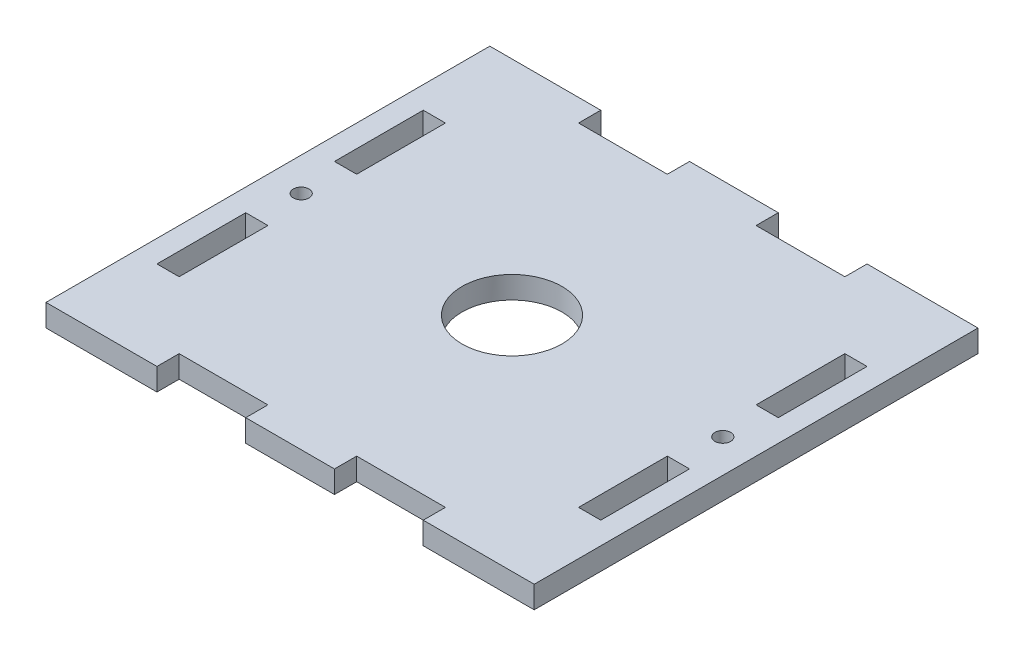
from build123d import *

# Parameters (mm, degrees)
SKETCH1_W                 = 139.7
SKETCH1_H                 = 127
BOSS_EXTRUDE1_DEPTH       = 6.35
SKETCH13_W                = 25.4
SKETCH13_H                = 6.35
CUT_EXTRUDE6_DEPTH        = 6.35
LPATTERN7_COUNT           = 2
LPATTERN7_PITCH           = 120.65
SKETCH14_W                = 6.35
SKETCH14_H                = 25.4
CUT_EXTRUDE7_DEPTH        = 6.35
F_8_CLEARANCE_HOLE1_D     = 4.4958
F_8_CLEARANCE_HOLE1_DEPTH = 10.16
F_8_CLEARANCE_HOLE1_TIP   = 1.350674586
SKETCH18_R                = 14.2875
CUT_EXTRUDE9_DEPTH        = 7.62


with BuildPart() as part:
    # Sketch1 → Boss-Extrude1 (new body)
    with BuildSketch(Plane(origin=(0, 0, 0), x_dir=(1, 0, 0), z_dir=(0, 1, 0))):
        with Locations((69.85, 63.5)):
            Rectangle(SKETCH1_W, SKETCH1_H)
    extrude(amount=BOSS_EXTRUDE1_DEPTH)

    # Sketch13 → Cut-Extrude6 (cut)
    with BuildSketch(Plane(origin=(0, 6.35, 0), x_dir=(1, 0, 0), z_dir=(0, 1, 0))):
        with Locations((44.45, 3.175)):
            Rectangle(SKETCH13_W, SKETCH13_H)
        with Locations((95.25, 3.175)):
            Rectangle(SKETCH13_W, SKETCH13_H)
    cut_extrude6 = extrude(amount=-CUT_EXTRUDE6_DEPTH, mode=Mode.SUBTRACT)

    # LPattern7: Cut-Extrude6 ×2
    with Locations(*[(0, 0, -i * LPATTERN7_PITCH) for i in range(1, LPATTERN7_COUNT)]):
        add(cut_extrude6, mode=Mode.SUBTRACT)

    # Sketch14 → Cut-Extrude7 (cut)
    with BuildSketch(Plane(origin=(0, 6.35, 0), x_dir=(1, 0, 0), z_dir=(0, 1, 0))):
        with Locations((9.525, 38.1)):
            Rectangle(SKETCH14_W, SKETCH14_H)
        with Locations((130.175, 38.1)):
            Rectangle(SKETCH14_W, SKETCH14_H)
        with Locations((130.175, 88.9)):
            Rectangle(SKETCH14_W, SKETCH14_H)
        with Locations((9.525, 88.9)):
            Rectangle(SKETCH14_W, SKETCH14_H)
    extrude(amount=-CUT_EXTRUDE7_DEPTH, mode=Mode.SUBTRACT)

    # #8 Clearance Hole1
    with Locations(Plane(origin=(0, 6.35, 0), x_dir=(1, 0, 0), z_dir=(0, 1, 0))):
        with Locations((9.525, 63.5), (130.175, 63.5)):
            Hole(F_8_CLEARANCE_HOLE1_D / 2, depth=F_8_CLEARANCE_HOLE1_DEPTH)
            with Locations((0, 0, -(F_8_CLEARANCE_HOLE1_DEPTH + F_8_CLEARANCE_HOLE1_TIP / 2))):  # 118° drill point
                Cone(0, F_8_CLEARANCE_HOLE1_D / 2, F_8_CLEARANCE_HOLE1_TIP, mode=Mode.SUBTRACT)

    # Sketch18 → Cut-Extrude9 (cut)
    with BuildSketch(Plane(origin=(0, 6.35, 0), x_dir=(1, 0, 0), z_dir=(0, 1, 0))):
        with Locations((69.85, 63.5)):
            Circle(SKETCH18_R)
    extrude(amount=-CUT_EXTRUDE9_DEPTH, mode=Mode.SUBTRACT)


solid = part.part
